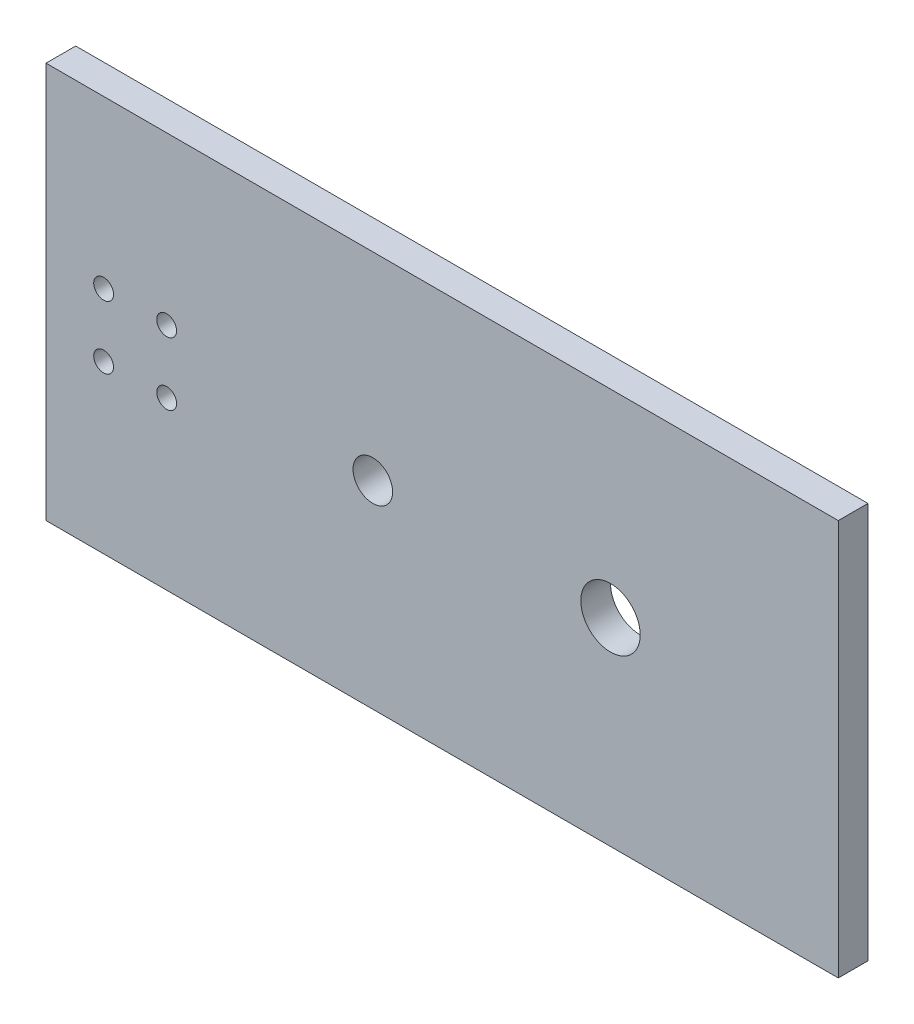
from build123d import *

# Parameters (mm, degrees)
SKETCH1_W           = 80
SKETCH1_H           = 40
BOSS_EXTRUDE1_DEPTH = 3
SKETCH2_R           = 1
CUT_EXTRUDE1_DEPTH  = 90.493016487


with BuildPart() as part:
    # Sketch1 → Boss-Extrude1 (new body)
    with BuildSketch(Plane.XY):
        with Locations((40, 20)):
            Rectangle(SKETCH1_W, SKETCH1_H)
    extrude(amount=BOSS_EXTRUDE1_DEPTH)

    # Sketch2 → Cut-Extrude1 (cut, through all)
    with BuildSketch(Plane.XY.offset(3)):
        with BuildLine():
            ThreePointArc((35, 20), (33, 22), (31, 20))
            Line((31, 20), (35, 20))
        make_face()
        with BuildLine():
            Line((35, 20), (31, 20))
            ThreePointArc((31, 20), (33, 18), (35, 20))
        make_face()
        with BuildLine():
            ThreePointArc((35, 20), (33, 22), (31, 20))
            Line((31, 20), (35, 20))
        make_face()
        with BuildLine():
            Line((35, 20), (31, 20))
            ThreePointArc((31, 20), (33, 18), (35, 20))
        make_face()
        with BuildLine():
            ThreePointArc((60, 20), (57, 23), (54, 20))
            Line((54, 20), (60, 20))
        make_face()
        with BuildLine():
            Line((60, 20), (54, 20))
            ThreePointArc((54, 20), (57, 17), (60, 20))
        make_face()
        with BuildLine():
            ThreePointArc((60, 20), (57, 23), (54, 20))
            Line((54, 20), (60, 20))
        make_face()
        with BuildLine():
            Line((60, 20), (54, 20))
            ThreePointArc((54, 20), (57, 17), (60, 20))
        make_face()
        with Locations((5.818019485, 23.181980515)):
            Circle(SKETCH2_R)
        with Locations((12.181980515, 23.181980515)):
            Circle(SKETCH2_R)
        with Locations((12.181980515, 16.818019485)):
            Circle(SKETCH2_R)
        with Locations((5.818019485, 16.818019485)):
            Circle(SKETCH2_R)
    extrude(amount=-CUT_EXTRUDE1_DEPTH, mode=Mode.SUBTRACT)


solid = part.part
